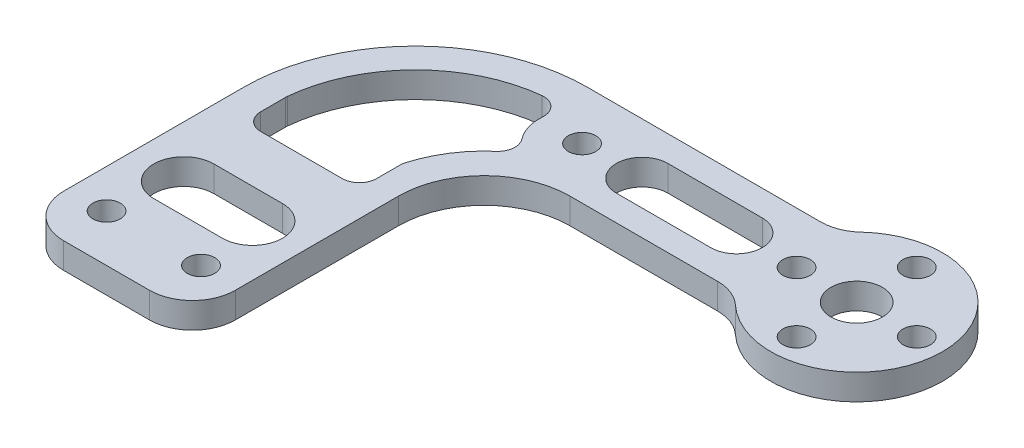
from build123d import *

# Parameters (mm, degrees)
SKETCH_1_R          = 10
SKETCH_1_R_2        = 3
SKETCH_1_R_3        = 1.6
SKETCH_1_R_4        = 1.600000000000001
SKETCH_1_R_5        = 1.6000000000000003
SKETCH_1_R_6        = 1.6000000000000019
EXTRUDE_1_DEPTH     = 3
EXTRUDE_2_DEPTH     = 3
SKETCH_3_R          = 1.5999999999999974
EXTRUDE_3_DEPTH     = 3
FILLET_1_R          = 10
FILLET_2_R          = 20
CUT_EXTRUDE_START   = -3
SKETCH_4_R          = 1.6000000000000019
SKETCH_4_R_2        = 1.599999999999998
CUT_EXTRUDE_1_DEPTH = 3
FILLET_3_R          = 5
FILLET_4_R          = 2


with BuildPart() as part:
    # 草图1 → 凸台-拉伸1 (new body)
    with BuildSketch(Plane(origin=(0, 0, 0), x_dir=(1, 0, 0), z_dir=(0, 1, 0))):
        with Locations(Location((0, 0, 0), (0, 0, 270))):
            Circle(SKETCH_1_R)
        with Locations(Location((0, 0, 0), (0, 0, 270))):
            Circle(SKETCH_1_R_2, mode=Mode.SUBTRACT)
        with Locations(Location((0, 6.999999999999999, 0), (0, 0, 270))):
            Circle(SKETCH_1_R_3, mode=Mode.SUBTRACT)
        with Locations(Location((6.999999999999998, 0, 0), (0, 0, 270))):
            Circle(SKETCH_1_R_4, mode=Mode.SUBTRACT)
        with Locations(Location((8.7e-16, -6.999999999999999, 0), (0, 0, 270))):
            Circle(SKETCH_1_R_5, mode=Mode.SUBTRACT)
        with Locations(Location((-6.999999999999999, -8.7e-16, 0), (0, 0, 270))):
            Circle(SKETCH_1_R_6, mode=Mode.SUBTRACT)
    extrude(amount=EXTRUDE_1_DEPTH)

    # 草图2 → 凸台-拉伸2 (add)
    with BuildSketch(Plane(origin=(0, 3, 0), x_dir=(1, 0, 0), z_dir=(0, 1, 0))):
        Polygon((-8.000000000000005, -5.999999999999994), (-57.4, -6), (-57.4, 6), (-8.000000000000005, 5.999999999999994), align=None)
    extrude(amount=-EXTRUDE_2_DEPTH)

    # 草图3 → 凸台-拉伸3 (add)
    with BuildSketch(Plane(origin=(0, 3, 0), x_dir=(1, 0, 0), z_dir=(0, 1, 0))):
        Polygon((-57.4, -6), (-37.399999999999984, -6), (-37.39999999999999, -40), (-57.39999999999999, -40), align=None)
        with Locations(Location((-52.89999999999999, -34.5, 0), (0, 0, 270))):
            Circle(SKETCH_3_R, mode=Mode.SUBTRACT)
        with Locations(Location((-41.89999999999999, -34.5, 0), (0, 0, 270))):
            Circle(SKETCH_3_R, mode=Mode.SUBTRACT)
    extrude(amount=-EXTRUDE_3_DEPTH)

    # 圆角1
    fillet_1_edges = [part.edges().sort_by_distance(p)[0] for p in [
        (-37.399999999999984, 1.5, 6),
    ]]
    fillet(fillet_1_edges, radius=FILLET_1_R)

    # 圆角2
    fillet_2_edges = [part.edges().sort_by_distance(p)[0] for p in [
        (-57.4, 1.5, -6),
    ]]
    fillet(fillet_2_edges, radius=FILLET_2_R)

    # 草图4 → 切除-拉伸1 (cut)
    with BuildSketch(Plane(origin=(0, 3, 0), x_dir=(1, 0, 0), z_dir=(0, 1, 0)).offset(CUT_EXTRUDE_START)):
        with Locations(Location((-6.999999999999999, -8.7e-16, 0), (0, 0, 270))):
            Circle(SKETCH_4_R)
        with Locations(Location((-32, 0, 0), (0, 0, 270))):
            Circle(SKETCH_4_R_2)
        with BuildLine():
            Line((-24.999999999999996, 3), (-13.999999999999998, 3))
            ThreePointArc((-13.999999999999998, 3), (-10.999999999999998, 0), (-13.999999999999998, -3))
            Line((-13.999999999999998, -3), (-24.999999999999996, -3))
            ThreePointArc((-24.999999999999996, -3), (-27.999999999999996, 3.7e-16), (-24.999999999999996, 3))
        make_face()
        with BuildLine():
            Line((-51.399999999999984, -23.500000000000004), (-43.39999999999999, -23.500000000000004))
            ThreePointArc((-43.39999999999999, -23.500000000000004), (-39.89999999999999, -27.000000000000004), (-43.39999999999999, -30.500000000000004))
            Line((-43.39999999999999, -30.500000000000004), (-51.399999999999984, -30.500000000000004))
            ThreePointArc((-51.399999999999984, -30.500000000000004), (-54.899999999999984, -27.000000000000004), (-51.399999999999984, -23.500000000000004))
        make_face()
        with BuildLine():
            Line((-40.43840481040531, -12.5), (-40.43840481040531, -17.500000000000004))
            Line((-40.43840481040531, -17.500000000000004), (-53.93871883229112, -17.500000000000007))
            Line((-53.93871883229112, -17.500000000000007), (-53.938718832291116, -12.5))
            ThreePointArc((-53.938718832291116, -12.5), (-48.18321723568186, -1.3706117859306186), (-36.28930043689978, 2.5694166190035115))
            ThreePointArc((-36.28930043689978, 2.5694166190035115), (-36.81589304125609, -1.3443117998370948), (-34.338414417674585, -4.419481645081424))
            ThreePointArc((-34.338414417674585, -4.419481645081424), (-38.17460072758567, -7.866244461436596), (-40.43840481040531, -12.5))
        make_face()
    extrude(amount=CUT_EXTRUDE_1_DEPTH, mode=Mode.SUBTRACT)

    # 圆角3
    fillet_3_edges = [part.edges().sort_by_distance(p)[0] for p in [
        (-8.000000000000005, 1.5, -5.999999999999994),
        (-8.000000000000005, 1.5, 5.999999999999994),
        (-57.39999999999999, 1.5, 40),
        (-37.39999999999999, 1.5, 40),
    ]]
    fillet(fillet_3_edges, radius=FILLET_3_R)

    # 圆角4
    # the kernel refuses this fillet: 2 mm, written as the material it adds along each edge
    with BuildSketch(Plane(origin=(-36.28930043689978, 0, -2.5694166190035155), x_dir=(-0.9997848253310014, 0, 0.020743746958035388), z_dir=(0, 1, 0))) as fillet_4_piece_1:
        with BuildLine():
            CenterArc((2.7332128689398965, 1.9923174543114084), FILLET_4_R, 174.54438439769004, 100.47920721380297)
            ThreePointArc((0.7422725749788821, 2.1824667269433027), (0.49863093433961686, 1.0478715203584514), (0, 0))
            ThreePointArc((0, 0), (1.4541723542762737, -0.06379048821461454), (2.9083447085525433, 0))
        make_face()
    extrude(amount=3)
    with BuildSketch(Plane(origin=(-34.338414417674585, 0, 4.419481645081424), x_dir=(-0.7648370504250814, 0, -0.6442237858827173), z_dir=(0, 1, 0))) as fillet_4_piece_2:
        with BuildLine():
            CenterArc((2.5407101067548044, 1.9546581979795647), FILLET_4_R, 170.9703370053984, 86.80615278737906)
            ThreePointArc((0.5654956678276036, 2.2685497720198655), (0.33194950705873716, 1.1220100755321154), (0, 0))
            ThreePointArc((0, 0), (1.0586292111478346, 0.11335450505108799), (2.117258422295671, -7e-17))
        make_face()
    extrude(amount=3)
    with BuildSketch(Plane(origin=(-40.43840481040531, 0, 17.500000000000004), x_dir=(0, 0, -1), z_dir=(0, 1, 0))) as fillet_4_piece_3:
        with BuildLine():
            CenterArc((FILLET_4_R, FILLET_4_R), FILLET_4_R, 180, 90)
            Line((0, FILLET_4_R), (0, 0))
            Line((0, 0), (FILLET_4_R, 0))
        make_face()
    extrude(amount=3)
    with BuildSketch(Plane(origin=(-53.93871883229112, 0, 17.500000000000007), x_dir=(1, 0, 0), z_dir=(0, 1, 0))) as fillet_4_piece_4:
        with BuildLine():
            CenterArc((FILLET_4_R, FILLET_4_R), FILLET_4_R, 179.99999999999986, 90.00000000000011)
            Line((7.11e-15, FILLET_4_R), (0, 0))
            Line((0, 0), (FILLET_4_R, 0))
        make_face()
    extrude(amount=3)
    with BuildSketch(Plane(origin=(-53.938718832291116, 0, 12.5), x_dir=(0.09331197212510238, 0, -0.9956369196941844), z_dir=(0, 1, 0))) as fillet_4_piece_5:
        with BuildLine():
            CenterArc((0.09361195431707342, -1.9999910052952001), FILLET_4_R, 89.8281631699166, 5.526008171417317)
            Line((-0.09301198993312956, -0.00871716590683111), (0, 0))
            ThreePointArc((0, 0), (0.04980509112364704, 7.468574010459e-05), (0.09961018224729987, 0))
        make_face()
    extrude(amount=3)
    # the kernel refuses this fillet: 2 mm, written as the material it takes off along each edge
    with BuildSketch(Plane(origin=(-40.43840481040531, -0.7436301227400532, 12.500000000000004), x_dir=(0.26988358130767626, 0, -0.9628929600638604), z_dir=(0, 1, 0))) as fillet_4_2_piece_1:
        with BuildLine():
            CenterArc((0.2754185639777855, -1.9998786277005756), FILLET_4_R, 89.36877437844454, 16.28856500222963)
            Line((-0.2643485986375687, -0.0740927075728552), (0, 0))
            ThreePointArc((0, 0), (0.14872602454800565, 0.00081926302110449), (0.29745204909602135, 1e-17))
        make_face()
    extrude(amount=4.4872602454801065, mode=Mode.SUBTRACT)


solid = part.part
